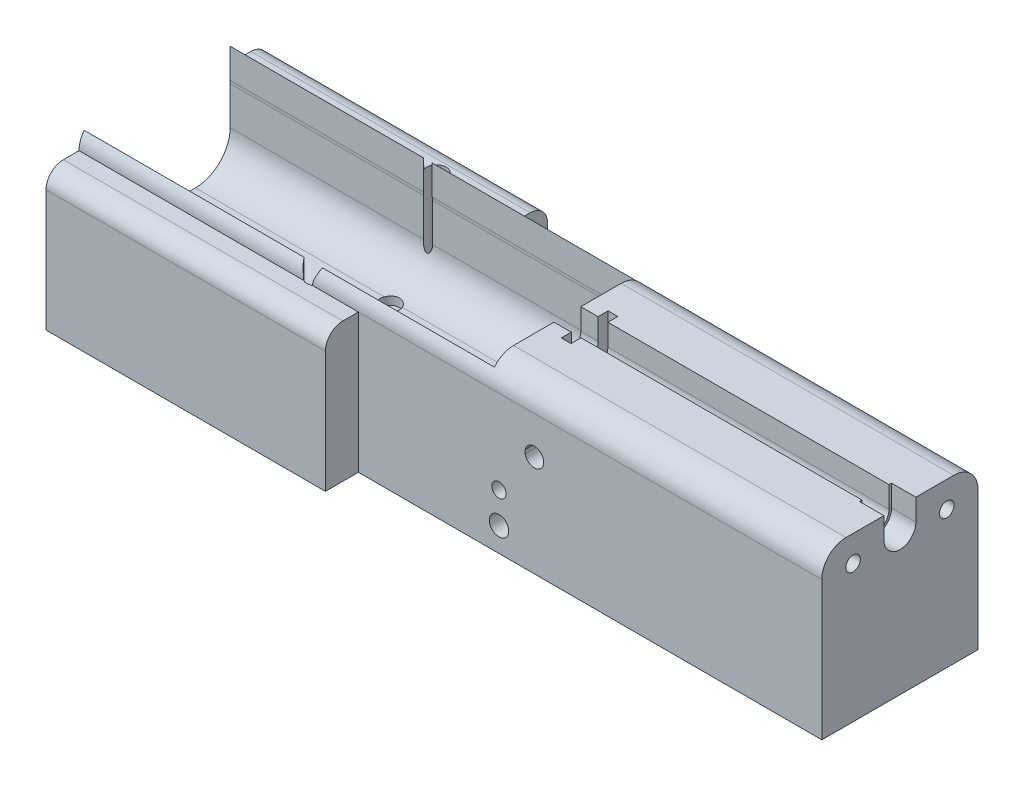
from build123d import *

# Parameters (mm, degrees)
SKETCH1_W           = 223
SKETCH1_H           = 45
BOSS_EXTRUDE1_DEPTH = 42
SKETCH7_W           = 118.2
SKETCH7_H           = 42
CUT_EXTRUDE17_DEPTH = 21
SKETCH4_W           = 7.75
SKETCH4_H           = 6.175
CUT_EXTRUDE14_DEPTH = 97.8
SKETCH5_R           = 3.875
CUT_EXTRUDE15_DEPTH = 97.8
SKETCH11_W          = 2.8
SKETCH11_H          = 13.5
CUT_EXTRUDE19_DEPTH = 11.5
CUT_EXTRUDE43_DEPTH = 7
SKETCH53_R          = 2.1
CUT_EXTRUDE44_DEPTH = 95
SKETCH68_R          = 2.65
CUT_EXTRUDE57_DEPTH = 28.3
BOSS_EXTRUDE2_DEPTH = 5
SKETCH42_W          = 80.5
SKETCH42_H          = 9.5
BOSS_EXTRUDE3_DEPTH = 35
SKETCH38_R          = 3.1
CUT_EXTRUDE32_DEPTH = 4.7
SKETCH40_R          = 5.5
CUT_EXTRUDE34_DEPTH = 9
SKETCH41_R          = 5.75
CUT_EXTRUDE35_DEPTH = 4
FILLET1_R           = 7
FILLET7_R           = 5
SKETCH47_R          = 1.5
CUT_EXTRUDE39_DEPTH = 7
SKETCH49_R          = 2.8
CUT_EXTRUDE41_DEPTH = 33
SKETCH56_W          = 15.8
SKETCH56_H          = 10.4
CUT_EXTRUDE47_DEPTH = 32.15
SKETCH57_W          = 5
SKETCH57_H          = 10.4
CUT_EXTRUDE48_DEPTH = 15
SKETCH58_R          = 2.8
SKETCH58_R_2        = 2.05
CUT_EXTRUDE49_DEPTH = 10
SKETCH59_R          = 1.5
SKETCH59_R_2        = 0.95
CUT_EXTRUDE50_DEPTH = 6.5
CUT_EXTRUDE51_START = -9
CUT_EXTRUDE51_DEPTH = 9
CUT_EXTRUDE52_DEPTH = 118.2
SKETCH64_R          = 1.5
CUT_EXTRUDE53_DEPTH = 14
SKETCH65_R          = 2.8
CUT_EXTRUDE54_DEPTH = 9.95
SKETCH66_R          = 1.5
CUT_EXTRUDE55_DEPTH = 25
SKETCH67_R          = 1.45
CUT_EXTRUDE56_DEPTH = 7
CUT_EXTRUDE58_START = -4
SKETCH69_R          = 2.8
CUT_EXTRUDE58_DEPTH = 41


with BuildPart() as part:
    # Sketch1 → Boss-Extrude1 (new body)
    with BuildSketch(Plane(origin=(0, 0, 0), x_dir=(1, 0, 0), z_dir=(0, 1, 0))):
        with Locations((111.5, 22.5)):
            Rectangle(SKETCH1_W, SKETCH1_H)
    extrude(amount=BOSS_EXTRUDE1_DEPTH)

    # Sketch7 → Cut-Extrude17 (cut)
    with BuildSketch(Plane(origin=(0, 42, 0), x_dir=(1, 0, 0), z_dir=(0, 1, 0))):
        with Locations((68.1, 22.5)):
            Rectangle(SKETCH7_W, SKETCH7_H)
    extrude(amount=-CUT_EXTRUDE17_DEPTH, mode=Mode.SUBTRACT)

    # Sketch4 → Cut-Extrude14 (cut)
    with BuildSketch(Plane(origin=(223, 0, 0), x_dir=(0, 0, -1), z_dir=(1, 0, 0))):
        with Locations((22.5, 38.9125)):
            Rectangle(SKETCH4_W, SKETCH4_H)
    extrude(amount=-CUT_EXTRUDE14_DEPTH, mode=Mode.SUBTRACT)

    # Sketch5 → Cut-Extrude15 (cut)
    with BuildSketch(Plane(origin=(223, 0, 0), x_dir=(0, 0, -1), z_dir=(1, 0, 0))):
        with Locations((22.5, 35.825)):
            Circle(SKETCH5_R)
    extrude(amount=-CUT_EXTRUDE15_DEPTH, mode=Mode.SUBTRACT)

    # Sketch11 → Cut-Extrude19 (cut)
    with BuildSketch(Plane(origin=(0, 42, 0), x_dir=(1, 0, 0), z_dir=(0, 1, 0))):
        with Locations((133.6, 22.5)):
            Rectangle(SKETCH11_W, SKETCH11_H)
    extrude(amount=-CUT_EXTRUDE19_DEPTH, mode=Mode.SUBTRACT)

    # Sketch52 → Cut-Extrude43 (cut)
    with BuildSketch(Plane(origin=(223, 0, 0), x_dir=(0, 0, -1), z_dir=(1, 0, 0))):
        with BuildLine():
            Line((17.9, 42), (17.9, 35.82))
            ThreePointArc((17.9, 35.82), (22.5, 31.22), (27.1, 35.82))
            Line((27.1, 35.82), (27.1, 42))
            Line((27.1, 42), (17.9, 42))
        make_face()
    extrude(amount=-CUT_EXTRUDE43_DEPTH, mode=Mode.SUBTRACT)

    # Sketch53 → Cut-Extrude44 (cut)
    with BuildSketch(Plane(origin=(223, 0, 0), x_dir=(0, 0, -1), z_dir=(1, 0, 0))):
        with Locations((9, 34.5)):
            Circle(SKETCH53_R)
        with Locations((36, 34.5)):
            Circle(SKETCH53_R)
    extrude(amount=-CUT_EXTRUDE44_DEPTH, mode=Mode.SUBTRACT)

    # Sketch68 → Cut-Extrude57 (cut)
    with BuildSketch(Plane.ZY.offset(-127.2)):
        with Locations((-9, 34.5)):
            Circle(SKETCH68_R)
        with Locations((-36, 34.5)):
            Circle(SKETCH68_R)
    extrude(amount=-CUT_EXTRUDE57_DEPTH, mode=Mode.SUBTRACT)

    # Sketch14 → Boss-Extrude2 (add)
    with BuildSketch(Plane.XZ):
        Polygon((9, -54.5), (89.5, -54.5), (89.5, -45), (223, -45), (223, 0), (89.5, 0), (89.5, 9.5), (9, 9.5), (9, 0), (0, 0), (0, -45), (9, -45), align=None)
    extrude(amount=BOSS_EXTRUDE2_DEPTH)

    # Sketch42 → Boss-Extrude3 (add)
    with BuildSketch(Plane(origin=(0, 0, 0), x_dir=(1, 0, 0), z_dir=(0, 1, 0))):
        with Locations((49.25, -4.75)):
            Rectangle(SKETCH42_W, SKETCH42_H)
        with Locations((49.25, 49.75)):
            Rectangle(SKETCH42_W, SKETCH42_H)
    extrude(amount=BOSS_EXTRUDE3_DEPTH)

    # Sketch38 → Cut-Extrude32 (cut)
    with BuildSketch(Plane(origin=(127.2, -5, -22.5), x_dir=(0, 0, -1), z_dir=(0, -1, 0))):
        with Locations((23.5, -61.2)):
            Circle(SKETCH38_R)
        with Locations((10, -61.2)):
            Circle(SKETCH38_R)
    extrude(amount=-CUT_EXTRUDE32_DEPTH, mode=Mode.SUBTRACT)

    # Sketch40 → Cut-Extrude34 (cut)
    with BuildSketch(Plane(origin=(127.2, -5, -22.5), x_dir=(0, 0, -1), z_dir=(0, -1, 0))):
        with Locations((0, -33.7)):
            Circle(SKETCH40_R)
    extrude(amount=-CUT_EXTRUDE34_DEPTH, mode=Mode.SUBTRACT)

    # Sketch41 → Cut-Extrude35 (cut)
    with BuildSketch(Plane(origin=(127.2, -5, -22.5), x_dir=(0, 0, -1), z_dir=(0, -1, 0))):
        with Locations((20, -73.2)):
            Circle(SKETCH41_R)
        with Locations((-20, -73.2)):
            Circle(SKETCH41_R)
    extrude(amount=-CUT_EXTRUDE35_DEPTH, mode=Mode.SUBTRACT)

    # Fillet1
    # the kernel refuses this fillet: 7 mm, written as the material it takes off along each edge
    with BuildSketch(Plane(origin=(240.5, 42, -45), x_dir=(0, 0, 1), z_dir=(-1, 0, 0))) as fillet1_piece_1:
        with BuildLine():
            CenterArc((FILLET1_R, -FILLET1_R), FILLET1_R, 90, 90)
            Line((0, -FILLET1_R), (0, 0))
            Line((0, 0), (FILLET1_R, 0))
        make_face()
    extrude(amount=258, mode=Mode.SUBTRACT)
    with BuildSketch(Plane(origin=(-17.5, 42, 0), x_dir=(0, -1, 0), z_dir=(1, 0, 0))) as fillet1_piece_2:
        with BuildLine():
            CenterArc((FILLET1_R, FILLET1_R), FILLET1_R, 180, 90)
            Line((0, FILLET1_R), (0, 0))
            Line((0, 0), (FILLET1_R, 0))
        make_face()
    extrude(amount=258, mode=Mode.SUBTRACT)

    # Fillet7
    fillet7_edges = [part.edges().sort_by_distance(p)[0] for p in [
        (49.25, 35, -54.5),
        (49.25, 35, 9.5),
    ]]
    fillet(fillet7_edges, radius=FILLET7_R)

    # Sketch47 → Cut-Extrude39 (cut)
    with BuildSketch(Plane(origin=(127.2, -0.3, -22.5), x_dir=(0, 0, -1), z_dir=(0, -1, 0))):
        with Locations((23.5, -61.2)):
            Circle(SKETCH47_R)
        with Locations((10, -61.2)):
            Circle(SKETCH47_R)
    extrude(amount=-CUT_EXTRUDE39_DEPTH, mode=Mode.SUBTRACT)

    # Sketch49 → Cut-Extrude41 (cut)
    with BuildSketch(Plane.XZ.offset(-6.7)):
        with Locations(Location((66, -32.5, 0), (0, 0, 270))):
            Circle(SKETCH49_R)
        with Locations(Location((66, -46, 0), (0, 0, 270))):
            Circle(SKETCH49_R)
    extrude(amount=-CUT_EXTRUDE41_DEPTH, mode=Mode.SUBTRACT)

    # Sketch56 → Cut-Extrude47 (cut)
    with BuildSketch(Plane.XZ.offset(5)):
        with Locations((135.1, -14.2)):
            Rectangle(SKETCH56_W, SKETCH56_H)
    extrude(amount=-CUT_EXTRUDE47_DEPTH, mode=Mode.SUBTRACT)

    # Sketch57 → Cut-Extrude48 (cut)
    with BuildSketch(Plane.XZ.offset(5)):
        with Locations((124.7, -14.2)):
            Rectangle(SKETCH57_W, SKETCH57_H)
    extrude(amount=-CUT_EXTRUDE48_DEPTH, mode=Mode.SUBTRACT)

    # Sketch58 → Cut-Extrude49 (cut)
    with BuildSketch(Plane(origin=(127.2, 21, 0), x_dir=(0, -1, 0), z_dir=(0, 0, 1))):
        with Locations(Location((19.05, 2.8, 0), (0, 0, 90))):
            Circle(SKETCH58_R)
        with Locations(Location((10.15, 2.8, 0), (0, 0, 90))):
            Circle(SKETCH58_R_2)
        with BuildLine():
            Line((-2.632795978, 15.65), (-3.667204022, 15.65))
            ThreePointArc((-3.667204022, 15.65), (-5.85, 13), (-3.667204022, 10.35))
            Line((-3.667204022, 10.35), (-2.632795978, 10.35))
            ThreePointArc((-2.632795978, 10.35), (-0.45, 13), (-2.632795978, 15.65))
        make_face()
    extrude(amount=-CUT_EXTRUDE49_DEPTH, mode=Mode.SUBTRACT)

    # Sketch59 → Cut-Extrude50 (cut)
    with BuildSketch(Plane.XY.offset(-19.4)):
        with Locations((130, 1.95)):
            Circle(SKETCH59_R)
        with Locations((130, 10.85)):
            Circle(SKETCH59_R_2)
        with Locations((140.2, 24.15)):
            Circle(SKETCH59_R)
    extrude(amount=-CUT_EXTRUDE50_DEPTH, mode=Mode.SUBTRACT)

    # Sketch62 → Cut-Extrude51 (cut)
    with BuildSketch(Plane.ZY.offset(CUT_EXTRUDE51_START)):
        with BuildLine():
            Line((0, -5), (-45, -5))
            Line((-45, -5), (-45, 35))
            ThreePointArc((-45, 35), (-42.949747468, 39.949747468), (-38, 42))
            Line((-38, 42), (-7, 42))
            ThreePointArc((-7, 42), (-2.050252532, 39.949747468), (0, 35))
            Line((0, 35), (0, -5))
        make_face()
    extrude(amount=CUT_EXTRUDE51_DEPTH, mode=Mode.SUBTRACT)

    # Sketch63 → Cut-Extrude52 (cut)
    with BuildSketch(Plane(origin=(127.2, 21, -22.5), x_dir=(0, 0, -1), z_dir=(-1, 0, 0))):
        with BuildLine():
            Line((-10.959716831, -18.950283169), (11.040283169, -18.950283169))
            ThreePointArc((11.040283169, -18.950283169), (18.111350981, -16.021350981), (21.040283169, -8.950283169))
            Line((21.040283169, -8.950283169), (21.040283169, 2.049716831))
            ThreePointArc((21.040283169, 2.049716831), (18.111350981, 9.120784643), (11.040283169, 12.049716831))
            Line((11.040283169, 12.049716831), (-10.959716831, 12.049716831))
            ThreePointArc((-10.959716831, 12.049716831), (-18.030784643, 9.120784643), (-20.959716831, 2.049716831))
            Line((-20.959716831, 2.049716831), (-20.959716831, -8.950283169))
            ThreePointArc((-20.959716831, -8.950283169), (-18.030784643, -16.021350981), (-10.959716831, -18.950283169))
        make_face()
    extrude(amount=CUT_EXTRUDE52_DEPTH, mode=Mode.SUBTRACT)

    # Sketch64 → Cut-Extrude53 (cut)
    with BuildSketch(Plane(origin=(127.2, -5, -22.5), x_dir=(0, 0, -1), z_dir=(0, -1, 0))):
        with Locations((-1, -71.2)):
            Circle(SKETCH64_R)
    extrude(amount=-CUT_EXTRUDE53_DEPTH, mode=Mode.SUBTRACT)

    # Sketch65 → Cut-Extrude54 (cut)
    with BuildSketch(Plane(origin=(127.2, 8.950283169, -22.5), x_dir=(0, 0, 1), z_dir=(0, 1, 0))):
        with Locations((1, -71.2)):
            Circle(SKETCH65_R)
    extrude(amount=-CUT_EXTRUDE54_DEPTH, mode=Mode.SUBTRACT)

    # Sketch66 → Cut-Extrude55 (cut)
    with BuildSketch(Plane(origin=(127.2, -5, -22.5), x_dir=(0, 0, -1), z_dir=(0, -1, 0))):
        with Locations((-20, -52.2)):
            Circle(SKETCH66_R)
    extrude(amount=-CUT_EXTRUDE55_DEPTH, mode=Mode.SUBTRACT)

    # Sketch67 → Cut-Extrude56 (cut)
    with BuildSketch(Plane(origin=(9, 21, -22.5), x_dir=(0, 0, -1), z_dir=(-1, 0, 0))):
        with Locations(Location((27, -9, 0), (0, 0, 180))):
            Circle(SKETCH67_R)
        with Locations(Location((27, 21, 0), (0, 0, 180))):
            Circle(SKETCH67_R)
        with Locations(Location((-27, 21, 0), (0, 0, 180))):
            Circle(SKETCH67_R)
        with Locations(Location((-27, -9, 0), (0, 0, 180))):
            Circle(SKETCH67_R)
    extrude(amount=-CUT_EXTRUDE56_DEPTH, mode=Mode.SUBTRACT)

    # Sketch69 → Cut-Extrude58 (cut)
    with BuildSketch(Plane(origin=(127.2, -5, -22.5), x_dir=(0, 0, -1), z_dir=(0, -1, 0)).offset(CUT_EXTRUDE58_START)):
        with Locations((-20, -52.2)):
            Circle(SKETCH69_R)
    extrude(amount=-CUT_EXTRUDE58_DEPTH, mode=Mode.SUBTRACT)


solid = part.part
